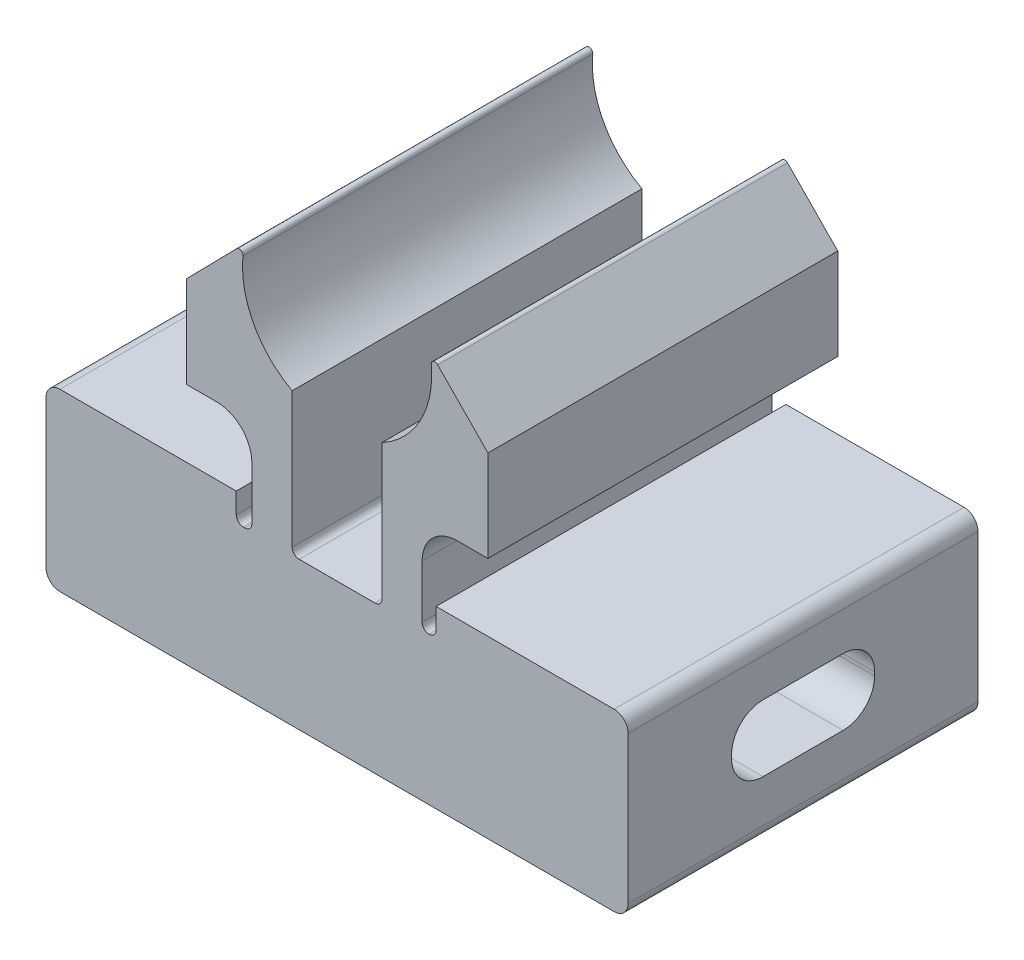
from build123d import *

# Parameters (mm, degrees)
BOSS_EXTRUDE9_DEPTH      = 6.35
SKETCH4_W                = 3.261538064
SKETCH4_H                = 3.965348827
CUT_EXTRUDE2_DEPTH       = 26.406776986
SKETCH5_W                = 1.630769032
SKETCH5_H                = 1.267236454
CUT_EXTRUDE6_DEPTH       = 26.406776986
SKETCH6_W                = 1.630769032
SKETCH6_H                = 1.247570224
CUT_EXTRUDE7_DEPTH       = 26.406776986
CUT_EXTRUDE9_DEPTH       = 23.902768758
CUT_EXTRUDE9_DEPTH_BACK  = 23.902768758
SKETCH8_W                = 0.566855721
SKETCH8_H                = 1.002964872
CUT_EXTRUDE10_DEPTH      = 26.406776986
CUT_EXTRUDE10_DEPTH_BACK = 26.406776986
SKETCH9_W                = 0.508
SKETCH9_H                = 1.002964872
FILLET1_R                = 0.254
FILLET2_R                = 0.254
FILLET3_R                = 0.254
FILLET4_R                = 0.508
FILLET5_R                = 0.508
SKETCH11_W               = 5.19034067
SKETCH11_H               = 2.415254944
CUT_EXTRUDE11_DEPTH      = 30.316944626
FILLET6_R                = 1.143


with BuildPart() as part:
    # Sketch2 → Boss-Extrude9 (new, symmetric)
    with BuildSketch(Plane.XY):
        with BuildLine():
            Line((-5.471488307, -10.4902), (-4.36371454, -10.4902))
            ThreePointArc((-4.36371454, -10.4902), (-3.465688928, -10.862174388), (-3.09371454, -11.7602))
            Line((-3.09371454, -11.7602), (-3.09371454, -12.937827191))
            Line((-3.09371454, -12.937827191), (-10.566399977, -12.937827191))
            Line((-10.566399977, -12.937827191), (-10.566399977, -19.301956075))
            Line((-10.566399977, -19.301956075), (10.566399977, -19.301956075))
            Line((10.566399977, -19.301956075), (10.566399977, -12.937827191))
            Line((10.566399977, -12.937827191), (3.086674887, -12.937827191))
            Line((3.086674887, -12.937827191), (3.086674887, -11.7602))
            ThreePointArc((3.086674887, -11.7602), (3.458649275, -10.862174388), (4.356674887, -10.4902))
            Line((4.356674887, -10.4902), (5.476039751, -10.4902))
            Line((5.476039751, -10.4902), (5.476039751, -7.173536635))
            Line((5.476039751, -7.173536635), (3.650231899, -5.31386943))
            ThreePointArc((3.650231899, -5.31386943), (3.496357897, -5.285953607), (3.418648834, -5.421665813))
            ThreePointArc((3.418648834, -5.421665813), (0.00035136, -9.18188013), (-3.418715481, -5.422365367))
            ThreePointArc((-3.418715481, -5.422365367), (-3.496506609, -5.286643819), (-3.650404442, -5.314701882))
            Line((-3.650404442, -5.314701882), (-5.471488307, -7.173600332))
            Line((-5.471488307, -7.173600332), (-5.471488307, -10.4902))
        make_face()
    extrude(amount=BOSS_EXTRUDE9_DEPTH, both=True)

    # Sketch4 → Cut-Extrude2 (cut, through all)
    with BuildSketch(Plane.XY.offset(6.35)):
        with Locations((0, -11.95811765)):
            Rectangle(SKETCH4_W, SKETCH4_H)
    extrude(amount=-CUT_EXTRUDE2_DEPTH, mode=Mode.SUBTRACT)

    # Sketch5 → Cut-Extrude6 (cut, through all)
    with BuildSketch(Plane.XY.offset(6.35)):
        with Locations((-0.815384516, -9.341825009)):
            Rectangle(SKETCH5_W, SKETCH5_H)
    extrude(amount=-CUT_EXTRUDE6_DEPTH, mode=Mode.SUBTRACT)

    # Sketch6 → Cut-Extrude7 (cut, through all)
    with BuildSketch(Plane(origin=(0, 0, -6.35), x_dir=(-1, 0, 0), z_dir=(0, 0, -1))):
        with Locations((-0.815384516, -9.351658124)):
            Rectangle(SKETCH6_W, SKETCH6_H)
    extrude(amount=-CUT_EXTRUDE7_DEPTH, mode=Mode.SUBTRACT)

    # Sketch8 → Cut-Extrude9 (cut, two sides: drawn at the far end of the back side and taken through both)
    with BuildSketch(Plane.XY.offset(-CUT_EXTRUDE9_DEPTH_BACK)):
        with Locations((-3.377142401, -13.439309627)):
            Rectangle(SKETCH8_W, SKETCH8_H)
    extrude(amount=CUT_EXTRUDE9_DEPTH + CUT_EXTRUDE9_DEPTH_BACK, mode=Mode.SUBTRACT)

    # Sketch9 → Cut-Extrude10 (cut, two sides: drawn at the far end of the back side and taken through both)
    with BuildSketch(Plane.XY.offset(6.35).offset(-CUT_EXTRUDE10_DEPTH_BACK)):
        with Locations((3.340674887, -13.439309627)):
            Rectangle(SKETCH9_W, SKETCH9_H)
    extrude(amount=CUT_EXTRUDE10_DEPTH + CUT_EXTRUDE10_DEPTH_BACK, mode=Mode.SUBTRACT)

    # Fillet1
    fillet1_edges = [part.edges().sort_by_distance(p)[0] for p in [
        (-3.09371454, -13.940792063, 0),
    ]]
    fillet(fillet1_edges, radius=FILLET1_R)

    # Fillet2
    fillet2_edges = [part.edges().sort_by_distance(p)[0] for p in [
        (-3.660570261, -13.940792063, 0),
    ]]
    fillet(fillet2_edges, radius=FILLET2_R)

    # Fillet3
    fillet3_edges = [part.edges().sort_by_distance(p)[0] for p in [
        (3.594674887, -13.940792063, 0),
        (3.086674887, -13.940792063, 0),
        (1.630769032, -13.940792063, 0),
        (-1.630769032, -13.940792063, 0),
    ]]
    fillet(fillet3_edges, radius=FILLET3_R - 0.0001)  # a hair under: the kernel refuses the full size

    # Fillet4
    fillet4_edges = [part.edges().sort_by_distance(p)[0] for p in [
        (-10.566399977, -12.937827191, 0),
    ]]
    fillet(fillet4_edges, radius=FILLET4_R)

    # Fillet5
    fillet5_edges = [part.edges().sort_by_distance(p)[0] for p in [
        (-10.566399977, -19.301956075, 0),
        (10.566399977, -12.937827191, 0),
        (10.566399977, -19.301956075, 0),
    ]]
    fillet(fillet5_edges, radius=FILLET5_R)

    # Sketch11 → Cut-Extrude11 (cut, through all)
    with BuildSketch(Plane.ZY.offset(10.566399977)):
        with Locations((0, -16.044100378)):
            Rectangle(SKETCH11_W, SKETCH11_H)
    extrude(amount=-CUT_EXTRUDE11_DEPTH, mode=Mode.SUBTRACT)

    # Fillet6
    fillet6_edges = [part.edges().sort_by_distance(p)[0] for p in [
        (0, -14.836472906, 2.595170335),
        (0, -17.25172785, 2.595170335),
        (0, -17.25172785, -2.595170335),
        (0, -14.836472906, -2.595170335),
    ]]
    fillet(fillet6_edges, radius=FILLET6_R)


solid = part.part
